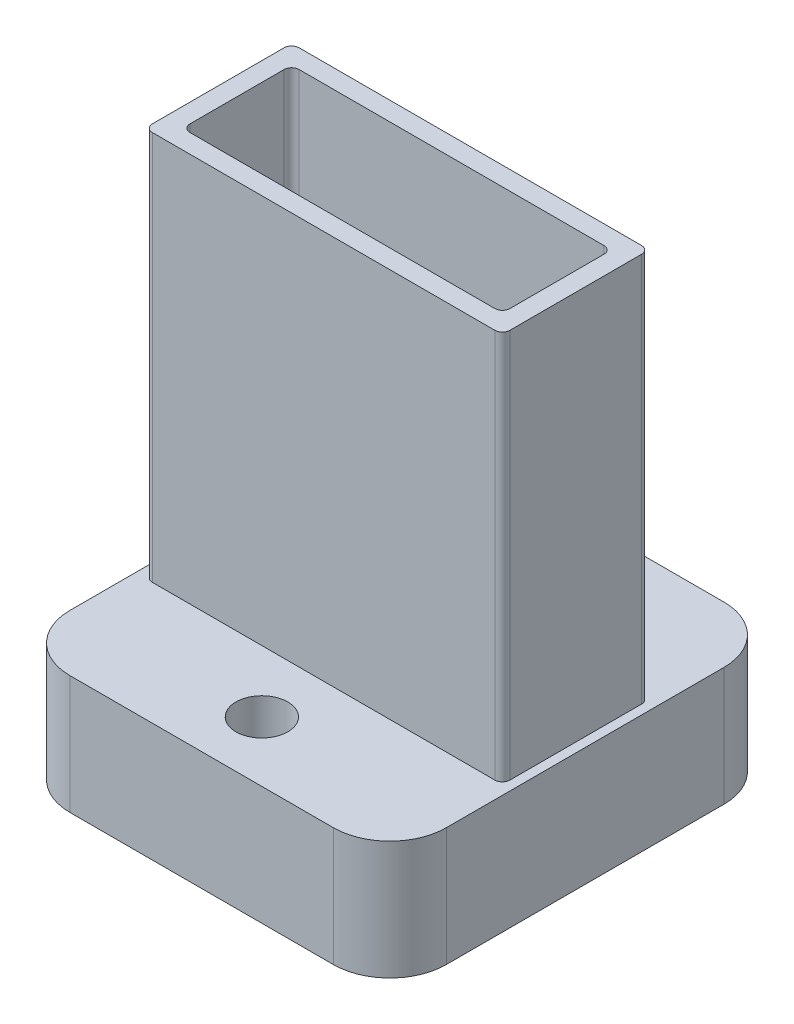
from build123d import *

# Parameters (mm, degrees)
BOSS_EXTRUDE1_DEPTH = 23.622
BOSS_EXTRUDE2_DEPTH = 10.668
SKETCH4_R           = 1.75
BOSS_EXTRUDE3_DEPTH = 8


with BuildPart() as part:
    # Sketch1 → Boss-Extrude1 (new body)
    with BuildSketch(Plane(origin=(0, 0, 0), x_dir=(1, 0, 0), z_dir=(0, 1, 0))):
        with BuildLine():
            Line((11.557, 4.953), (-11.557, 4.953))
            ThreePointArc((-11.557, 4.953), (-11.916210245, 4.804210245), (-12.065, 4.445))
            Line((-12.065, 4.445), (-12.065, -4.445))
            ThreePointArc((-12.065, -4.445), (-11.916210245, -4.804210245), (-11.557, -4.953))
            Line((-11.557, -4.953), (11.557, -4.953))
            ThreePointArc((11.557, -4.953), (11.916210245, -4.804210245), (12.065, -4.445))
            Line((12.065, -4.445), (12.065, 4.445))
            ThreePointArc((12.065, 4.445), (11.916210245, 4.804210245), (11.557, 4.953))
        make_face()
    extrude(amount=BOSS_EXTRUDE1_DEPTH)

    # Sketch2 → Boss-Extrude2 (add)
    with BuildSketch(Plane(origin=(0, 23.622, 0), x_dir=(1, 0, 0), z_dir=(0, 1, 0))):
        with BuildLine():
            Line((11.557, 4.953), (-11.557, 4.953))
            ThreePointArc((-11.557, 4.953), (-11.916210245, 4.804210245), (-12.065, 4.445))
            Line((-12.065, 4.445), (-12.065, -4.445))
            ThreePointArc((-12.065, -4.445), (-11.916210245, -4.804210245), (-11.557, -4.953))
            Line((-11.557, -4.953), (11.557, -4.953))
            ThreePointArc((11.557, -4.953), (11.916210245, -4.804210245), (12.065, -4.445))
            Line((12.065, -4.445), (12.065, 4.445))
            ThreePointArc((12.065, 4.445), (11.916210245, 4.804210245), (11.557, 4.953))
        make_face()
        with BuildLine():
            Line((10.287, -3.683), (-10.287, -3.683))
            ThreePointArc((-10.287, -3.683), (-10.646210245, -3.534210245), (-10.795, -3.175))
            Line((-10.795, -3.175), (-10.795, 3.175))
            ThreePointArc((-10.795, 3.175), (-10.646210245, 3.534210245), (-10.287, 3.683))
            Line((-10.287, 3.683), (10.287, 3.683))
            ThreePointArc((10.287, 3.683), (10.646210245, 3.534210245), (10.795, 3.175))
            Line((10.795, 3.175), (10.795, -3.175))
            ThreePointArc((10.795, -3.175), (10.646210245, -3.534210245), (10.287, -3.683))
        make_face(mode=Mode.SUBTRACT)
    extrude(amount=BOSS_EXTRUDE2_DEPTH)

    # Sketch4 → Boss-Extrude3 (add)
    with BuildSketch(Plane(origin=(0, 0, 0), x_dir=(1, 0, 0), z_dir=(0, 1, 0))):
        with BuildLine():
            Line((-8.89, -13.184), (8.89, -13.184))
            ThreePointArc((8.89, -13.184), (11.584076836, -12.068076836), (12.7, -9.374))
            Line((12.7, -9.374), (12.7, 9.374))
            ThreePointArc((12.7, 9.374), (11.584076836, 12.068076836), (8.89, 13.184))
            Line((8.89, 13.184), (-8.89, 13.184))
            ThreePointArc((-8.89, 13.184), (-11.584076836, 12.068076836), (-12.7, 9.374))
            Line((-12.7, 9.374), (-12.7, -9.374))
            ThreePointArc((-12.7, -9.374), (-11.584076836, -12.068076836), (-8.89, -13.184))
        make_face()
        with Locations((0, -9.12)):
            Circle(SKETCH4_R, mode=Mode.SUBTRACT)
        with Locations((0, 9.12)):
            Circle(SKETCH4_R, mode=Mode.SUBTRACT)
    extrude(amount=BOSS_EXTRUDE3_DEPTH)


solid = part.part
